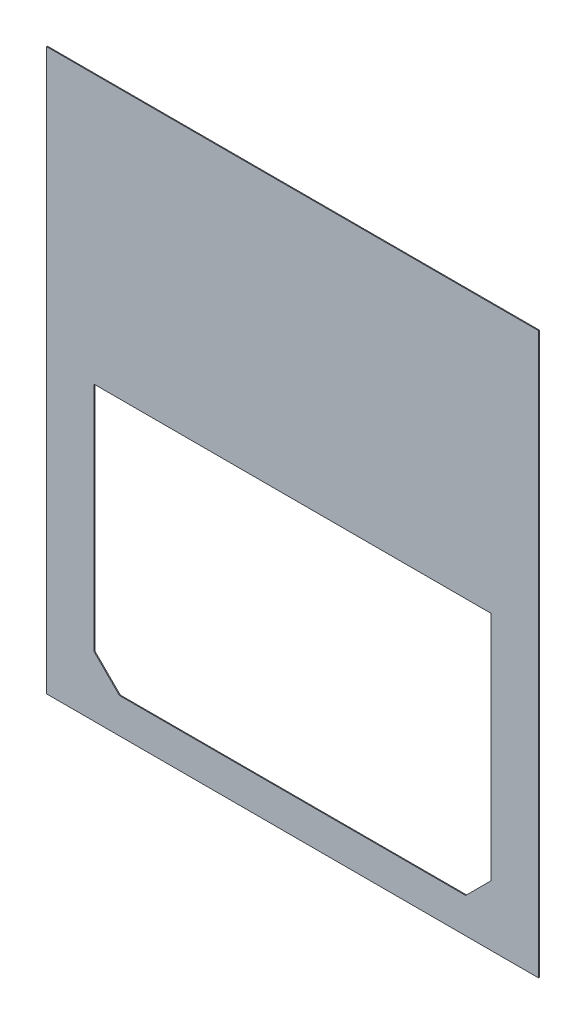
from build123d import *

# Parameters (mm, degrees)
SKETCH1_W          = 843
SKETCH1_H          = 960
BASE_FLANGE1_DEPTH = 1.5


# Sheet-metal steps are written as plain solids
with BuildPart() as part:
    # Sketch1 → Base-Flange1 (new body)
    with BuildSketch(Plane.XY):
        with Locations((0, 480)):
            Rectangle(SKETCH1_W, SKETCH1_H)
        Polygon((-340, 500), (-340, 103.5), (-296.5, 60), (296.5, 60), (340, 103.5), (340, 500), align=None, mode=Mode.SUBTRACT)
    extrude(amount=-BASE_FLANGE1_DEPTH)


solid = part.part
